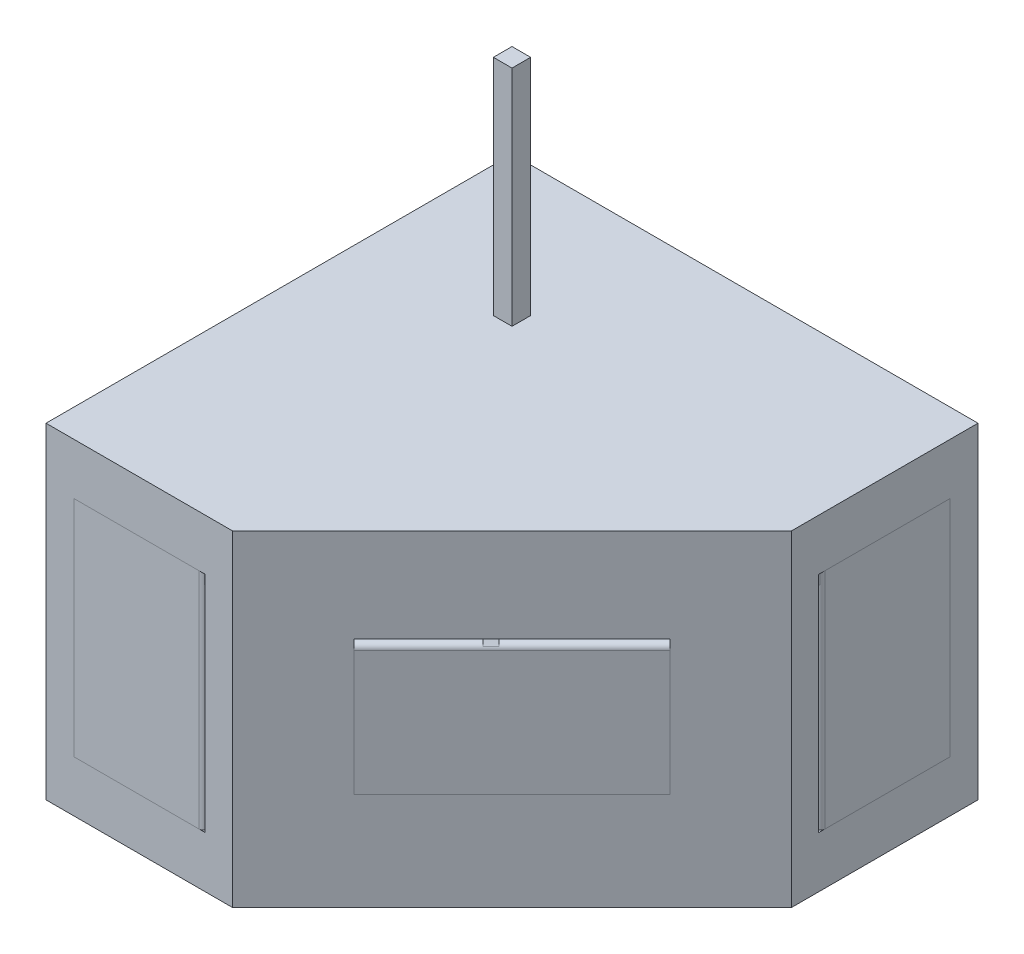
from build123d import *

# Parameters (mm, degrees)
SKETCH1_W                       = 10
SKETCH1_H                       = 10
BOSS_EXTRUDE1_DEPTH             = 175
SHELL1_T                        = 6
SKETCH1_5_W                     = 10
SKETCH1_5_H                     = 10
CUT_EXTRUDE2_DEPTH              = 10
BOSS_EXTRUDE2_DEPTH             = 120
BOSS_EXTRUDE2_DEPTH_BACK        = 12
SKETCH1_3_W                     = 10
SKETCH1_3_H                     = 10
SKETCH3_W                       = 70
SKETCH3_H                       = 120
CUT_EXTRUDE3_DEPTH              = 6
SKETCH4_W                       = 120
SKETCH4_H                       = 70
CUT_EXTRUDE4_DEPTH              = 6
SKETCH5_W                       = 70
SKETCH5_H                       = 120
CUT_EXTRUDE5_DEPTH              = 6
BOSS_EXTRUDE3_START             = 6
SKETCH7_W                       = 10
SKETCH7_H                       = 6
SKETCH7_W_2                     = 38
BOSS_EXTRUDE3_DEPTH             = 6
BOSS_EXTRUDE4_START             = 12
SKETCH7_3_W                     = 10
SKETCH7_3_H                     = 6
BOSS_EXTRUDE4_DEPTH             = 62
BOSS_EXTRUDE5_DEPTH             = 6
CUT_EXTRUDE6_DEPTH              = 3
SKETCH11_R                      = 1.5
BOSS_EXTRUDE6_DEPTH             = 15
SKETCH12_R                      = 1.5
BOSS_EXTRUDE7_DEPTH             = 6
SKETCH12_3_R                    = 1.5
BOSS_EXTRUDE8_DEPTH             = 27.5
SKETCH13_R                      = 1.5
BOSS_EXTRUDE9_DEPTH             = 120
BOSS_EXTRUDE10_DEPTH            = 6
BOSS_EXTRUDE14_DEPTH            = 126
BOSS_EXTRUDE14_DEPTH_BACK       = 6
SKETCH13_10_R                   = 1.5
INDENT1_START                   = -153.5
INDENT1_OUTLINE_R               = 1.5
INDENT1_DEPTH                   = 132
CUT_EXTRUDE12_DEPTH             = 120
SKETCH15_R                      = 1.5
BOSS_EXTRUDE15_DEPTH            = 6
SKETCH15_3_R                    = 1.5
BOSS_EXTRUDE16_DEPTH            = 21.5
CUT_EXTRUDE13_DEPTH             = 3
SKETCH17_R                      = 1.5
BOSS_EXTRUDE17_DEPTH            = 15
CUT_EXTRUDE14_DEPTH             = 3
BOSS_EXTRUDE18_REACH            = 395.172
SKETCH20_W                      = 3
SKETCH20_H                      = 3
SKETCH21_R                      = 1.5
CUT_EXTRUDE15_DEPTH             = 120
SKETCH21_5_R                    = 1.5
BOSS_EXTRUDE19_DEPTH            = 120
BOSS_EXTRUDE20_DEPTH            = 6
BOSS_EXTRUDE21_DEPTH            = 126
BOSS_EXTRUDE21_DEPTH_BACK       = 6
SKETCH21_7_R                    = 1.5
INDENT2_START                   = -153.5
INDENT2_OUTLINE_R               = 1.5
INDENT2_DEPTH                   = 132
BOSS_EXTRUDE22_DEPTH            = 7.071068
CUT_EXTRUDE16_DEPTH             = 395.493345951
CUT_EXTRUDE16_DEPTH_BACK        = 395.493345951
CUT_EXTRUDE17_DEPTH             = 12
SKETCH27_W                      = 1.5
SKETCH27_H                      = 6
SKETCH27_W_2                    = 69.32734547
SKETCH27_H_2                    = 1.5
SKETCH27_H_3                    = 31.5
BOSS_EXTRUDE23_DEPTH            = 6
BOSS_EXTRUDE25_DEPTH            = 6
SKETCH29_3_W                    = 6
SKETCH29_3_H                    = 6
BOSS_EXTRUDE26_DEPTH            = 6
SKETCH30_W                      = 1.5
SKETCH30_H                      = 1.5
BOSS_EXTRUDE27_DEPTH            = 6
BOSS_EXTRUDE28_START            = 12
BOSS_EXTRUDE28_DEPTH            = 6
BOSS_EXTRUDE29_START            = 12
SKETCH30_4_R                    = 1.5
BOSS_EXTRUDE29_DEPTH            = 6
CUT_EXTRUDE20_REACH             = 396.493
SKETCH31_R                      = 1.5
CUT_EXTRUDE20_DIRECTION_2_REACH = 396.493
SKETCH31_3_R                    = 1.5
BOSS_EXTRUDE32_DEPTH            = 60
SKETCH31_4_R                    = 1.5
BOSS_EXTRUDE33_DEPTH            = 60
BOSS_EXTRUDE34_DEPTH            = 66
BOSS_EXTRUDE34_DEPTH_BACK       = 66
SKETCH31_5_R                    = 1.5
BOSS_EXTRUDE35_START            = -4.928932
BOSS_EXTRUDE35_DEPTH            = 5.999999999
INDENT3_START                   = -66
INDENT3_OUTLINE_R               = 1.5
INDENT3_DEPTH                   = 132
INDENT3_START_2                 = -60
INDENT3_2_DEPTH                 = 120


# Read off the part's stored shape, not the designer's step: Indent1, Indent2, Indent3
with BuildPart() as part:
    # Sketch1 → Boss-Extrude1 (new body)
    # profile 1 of 2: a face of its own
    with BuildSketch(Plane(origin=(0, 0, 0), x_dir=(1, 0, 0), z_dir=(0, 1, 0))):
        Polygon((250, -100), (250, 0), (0, 0), (0, -250), (100, -250), align=None)
        with Locations((75, -75)):
            Rectangle(SKETCH1_W, SKETCH1_H, mode=Mode.SUBTRACT)
    # profile 2 of 2: a face of its own
    with BuildSketch(Plane(origin=(0, 0, 0), x_dir=(1, 0, 0), z_dir=(0, 1, 0))):
        with Locations((75, -75)):
            Rectangle(SKETCH1_W, SKETCH1_H)
    extrude(amount=-BOSS_EXTRUDE1_DEPTH)

    # Shell1 (no face opened: a closed hollow body)
    add(offset(amount=-SHELL1_T, mode=Mode.PRIVATE), mode=Mode.SUBTRACT)

    # Sketch1<5> → Cut-Extrude2 (cut)
    with BuildSketch(Plane(origin=(0, 0, 0), x_dir=(1, 0, 0), z_dir=(0, 1, 0))):
        with Locations((75, -75)):
            Rectangle(SKETCH1_5_W, SKETCH1_5_H)
    extrude(amount=-CUT_EXTRUDE2_DEPTH, mode=Mode.SUBTRACT)

    # Sketch3 → Cut-Extrude3 (cut)
    with BuildSketch(Plane.XY.offset(250)):
        with Locations((50, -87.5)):
            Rectangle(SKETCH3_W, SKETCH3_H)
    extrude(amount=-CUT_EXTRUDE3_DEPTH, mode=Mode.SUBTRACT)

    # Sketch4 → Cut-Extrude4 (cut)
    with BuildSketch(Plane(origin=(175, 0, 175), x_dir=(0.7071067811865475, 0, -0.7071067811865476), z_dir=(0.7071067811865476, 0, 0.7071067811865475))):
        with Locations((0, -87.5)):
            Rectangle(SKETCH4_W, SKETCH4_H)
    extrude(amount=-CUT_EXTRUDE4_DEPTH, mode=Mode.SUBTRACT)

    # Sketch5 → Cut-Extrude5 (cut)
    with BuildSketch(Plane(origin=(250, 0, 0), x_dir=(0, 0, -1), z_dir=(1, 0, 0))):
        with Locations((-50, -87.5)):
            Rectangle(SKETCH5_W, SKETCH5_H)
    extrude(amount=-CUT_EXTRUDE5_DEPTH, mode=Mode.SUBTRACT)

    # Sketch10 → Cut-Extrude6 (cut)
    with BuildSketch(Plane(origin=(6, 0, 0), x_dir=(0, 0, -1), z_dir=(1, 0, 0))):
        with BuildLine():
            Line((-66.462699284, -15.332431655), (-36.462699284, -147.332431655))
            ThreePointArc((-36.462699284, -147.332431655), (-34.667568345, -148.462699284), (-33.537300716, -146.667568345))
            Line((-33.537300716, -146.667568345), (-63.537300716, -14.667568345))
            ThreePointArc((-63.537300716, -14.667568345), (-65.332431655, -13.537300716), (-66.462699284, -15.332431655))
        make_face()
    extrude(amount=-CUT_EXTRUDE6_DEPTH, mode=Mode.SUBTRACT)

    # Indent1 outline → Indent1 (cut)
    with BuildSketch(Plane(origin=(0, 0, 0), x_dir=(1, 0, 0), z_dir=(0, 1, 0)).offset(INDENT1_START)):
        with Locations((247, -82)):
            Circle(INDENT1_OUTLINE_R)
    extrude(amount=INDENT1_DEPTH, mode=Mode.SUBTRACT)

    # Sketch14 → Cut-Extrude12 (cut)
    with BuildSketch(Plane.XZ.offset(27.5)):
        with BuildLine():
            Line((247.520944533, 79.045576741), (257.369022063, 80.782058518))
            ThreePointArc((257.369022063, 80.782058518), (259.802500789, 84.25742631), (256.327132997, 86.690905036))
            Line((256.327132997, 86.690905036), (246.479055467, 84.954423259))
            ThreePointArc((246.479055467, 84.954423259), (244.045576741, 81.479055467), (247.520944533, 79.045576741))
        make_face()
    extrude(amount=CUT_EXTRUDE12_DEPTH, mode=Mode.SUBTRACT)

    # Sketch16 → Cut-Extrude13 (cut)
    with BuildSketch(Plane.XZ.offset(6)):
        with BuildLine():
            Line((44.528775724, 153.683385678), (114.528775724, 183.683385678))
            ThreePointArc((114.528775724, 183.683385678), (115.316614322, 185.652982171), (113.347017829, 186.440820768))
            Line((113.347017829, 186.440820768), (43.347017829, 156.440820768))
            ThreePointArc((43.347017829, 156.440820768), (42.559179232, 154.471224276), (44.528775724, 153.683385678))
        make_face()
    extrude(amount=-CUT_EXTRUDE13_DEPTH, mode=Mode.SUBTRACT)

    # Sketch18 → Cut-Extrude14 (cut)
    with BuildSketch(Plane.XZ.offset(6)):
        Polygon((113.937896777, 216.562103223), (43.937896777, 216.562103223), (42.437896777, 216.562103223), (42.437896777, 213.562103223), (43.937896777, 213.562103223), (113.937896777, 213.562103223), (115.437896777, 213.562103223), (115.437896777, 216.562103223), align=None)
    extrude(amount=-CUT_EXTRUDE14_DEPTH, mode=Mode.SUBTRACT)

    # Sketch21 → Cut-Extrude15 (cut)
    # profile 1 of 4: a face of its own
    with BuildSketch(Plane.XZ.offset(27.5)):
        Polygon((79.251006478, 250), (15, 250), (15, 244), (80.757359313, 244), (78.889491735, 245.867867578), align=None)
    # profile 2 of 4: a face of its own
    with BuildSketch(Plane.XZ.offset(27.5)):
        with BuildLine():
            Line((84.85085067, 314.006512), (79.251006478, 250))
            Line((79.251006478, 250), (82, 250))
            ThreePointArc((82, 250), (83.148050297, 249.771638598), (84.121320344, 249.121320344))
            Line((84.121320344, 249.121320344), (85.110508265, 248.132132422))
            Line((85.110508265, 248.132132422), (90.828018858, 313.483577544))
            ThreePointArc((90.828018858, 313.483577544), (88.100901992, 316.733628866), (84.85085067, 314.006512))
        make_face()
    # profile 3 of 4: a face of its own
    with BuildSketch(Plane.XZ.offset(27.5)):
        with BuildLine():
            Line((82, 250), (79.251006478, 250))
            Line((79.251006478, 250), (78.889491735, 245.867867578))
            Line((78.889491735, 245.867867578), (80.757359313, 244))
            Line((80.757359313, 244), (82, 244))
            ThreePointArc((82, 244), (84.771638598, 245.851949703), (84.121320344, 249.121320344))
            ThreePointArc((84.121320344, 249.121320344), (83.148050297, 249.771638598), (82, 250))
        make_face()
        with Locations((82, 247)):
            Circle(SKETCH21_R, mode=Mode.SUBTRACT)
    # profile 4 of 4: a face of its own
    with BuildSketch(Plane.XZ.offset(27.5)):
        with BuildLine():
            Line((82, 244), (80.757359313, 244))
            Line((80.757359313, 244), (102.462183044, 222.295176269))
            Line((102.462183044, 222.295176269), (111.816576433, 212.94078288))
            ThreePointArc((111.816576433, 212.94078288), (116.05921712, 212.94078288), (116.05921712, 217.183423567))
            Line((116.05921712, 217.183423567), (106.704823731, 226.537816956))
            Line((106.704823731, 226.537816956), (85.110508265, 248.132132422))
            Line((85.110508265, 248.132132422), (84.121320344, 249.121320344))
            ThreePointArc((84.121320344, 249.121320344), (84.771638598, 245.851949703), (82, 244))
        make_face()
        with BuildLine():
            Line((112.877236605, 214.001443052), (103.522843216, 223.355836441))
            ThreePointArc((103.522843216, 223.355836441), (103.522843216, 225.477156784), (105.644163559, 225.477156784))
            Line((105.644163559, 225.477156784), (114.998556948, 216.122763395))
            ThreePointArc((114.998556948, 216.122763395), (114.998556948, 214.001443052), (112.877236605, 214.001443052))
        make_face(mode=Mode.SUBTRACT)
    extrude(amount=CUT_EXTRUDE15_DEPTH, mode=Mode.SUBTRACT)

    # Indent2 outline → Indent2 (cut)
    with BuildSketch(Plane(origin=(0, 0, 0), x_dir=(1, 0, 0), z_dir=(0, 1, 0)).offset(INDENT2_START)):
        with Locations((82, -247)):
            Circle(INDENT2_OUTLINE_R)
    extrude(amount=INDENT2_DEPTH, mode=Mode.SUBTRACT)

    # Sketch29 → Boss-Extrude25 (add)
    # profile 1 of 2: a face of its own
    with BuildSketch(Plane(origin=(9.242640687, 0, -9.242640687), x_dir=(-0.7071067811865476, 0, -0.7071067811865475), z_dir=(0.7071067811865475, 0, -0.7071067811865476))):
        with BuildLine():
            ThreePointArc((-224.076644221, -94.158359214), (-222.735003434, -98.183281573), (-218.710081075, -96.841640786))
            Line((-218.710081075, -96.841640786), (-204.393362648, -68.208203932))
            Line((-204.393362648, -68.208203932), (-204.393362648, -169))
            ThreePointArc((-204.393362648, -169), (-201.393362648, -172), (-198.393362648, -169))
            Line((-198.393362648, -169), (-198.393362648, -58.44542097))
            Line((-198.393362648, -58.44542097), (-178.393362648, -58.5))
            Line((-178.393362648, -58.5), (-178.393362648, -64.5))
            Line((-178.393362648, -64.5), (-172.393362648, -64.5))
            Line((-172.393362648, -64.5), (-172.393362648, -46.5))
            Line((-172.393362648, -46.5), (-178.393362648, -46.5))
            Line((-178.393362648, -46.5), (-178.393362648, -52.5))
            Line((-178.393362648, -52.5), (-196.539260681, -52.5))
            Line((-196.539260681, -52.5), (-178.710081075, -16.841640786))
            ThreePointArc((-178.710081075, -16.841640786), (-180.051721861, -12.816718427), (-184.076644221, -14.158359214))
            Line((-184.076644221, -14.158359214), (-224.076644221, -94.158359214))
        make_face()
        with BuildLine():
            ThreePointArc((-220.051721861, -96.170820393), (-222.064183041, -96.841640786), (-222.735003434, -94.829179607))
            Line((-222.735003434, -94.829179607), (-182.735003434, -14.829179607))
            ThreePointArc((-182.735003434, -14.829179607), (-180.722542254, -14.158359214), (-180.051721861, -16.170820393))
            Line((-180.051721861, -16.170820393), (-220.051721861, -96.170820393))
        make_face(mode=Mode.SUBTRACT)
    # profile 2 of 2: a face of its own
    with BuildSketch(Plane(origin=(9.242640687, 0, -9.242640687), x_dir=(-0.7071067811865476, 0, -0.7071067811865475), z_dir=(0.7071067811865475, 0, -0.7071067811865476))):
        with BuildLine():
            ThreePointArc((-148.937090391, -149.129977814), (-146.936039364, -152.871073213), (-143.194943965, -150.870022186))
            Line((-143.194943965, -150.870022186), (-129.066017178, -104.24456379))
            Line((-129.066017178, -104.24456379), (-129.066017178, -169))
            ThreePointArc((-129.066017178, -169), (-126.066017178, -172), (-123.066017178, -169))
            Line((-123.066017178, -169), (-123.066017178, -84.44456379))
            Line((-123.066017178, -84.44456379), (-103.194943965, -18.870022186))
            ThreePointArc((-103.194943965, -18.870022186), (-105.195994992, -15.128926787), (-108.937090391, -17.129977814))
            Line((-108.937090391, -17.129977814), (-148.937090391, -149.129977814))
        make_face()
        with BuildLine():
            ThreePointArc((-144.630480571, -150.435011093), (-146.501028271, -151.435536607), (-147.501553785, -149.564988907))
            Line((-147.501553785, -149.564988907), (-107.501553785, -17.564988907))
            ThreePointArc((-107.501553785, -17.564988907), (-105.631006085, -16.564463393), (-104.630480571, -18.435011093))
            Line((-104.630480571, -18.435011093), (-144.630480571, -150.435011093))
        make_face(mode=Mode.SUBTRACT)
    extrude(amount=BOSS_EXTRUDE25_DEPTH)

    # Sketch29<3> → Boss-Extrude26 (add)
    with BuildSketch(Plane(origin=(9.242640687, 0, -9.242640687), x_dir=(-0.7071067811865476, 0, -0.7071067811865475), z_dir=(0.7071067811865475, 0, -0.7071067811865476))):
        with Locations((-175.393362648, -49.5)):
            Rectangle(SKETCH29_3_W, SKETCH29_3_H)
        with Locations((-175.393362648, -61.5)):
            Rectangle(SKETCH29_3_W, SKETCH29_3_H)
    extrude(amount=-BOSS_EXTRUDE26_DEPTH)

    # Cut-Extrude20: up to this face of the body (flat: up to its plane)
    cut_extrude20_end = Plane(part.part.faces().sort_by_distance((130.452272785, -87.5, 215.305086528))[0])
    # Sketch31 → Cut-Extrude20 (cut, up to the picked face)
    with BuildSketch(Plane(origin=(0, 0, 0), x_dir=(0, 1, 0), z_dir=(0.7071067811865475, 0, -0.7071067811865476)), mode=Mode.PRIVATE) as cut_extrude20_sk1:
        with BuildLine():
            Line((-36.05332074, 284.170009932), (-57.232050808, 247.487373415))
            Line((-57.232050808, 247.487373415), (-55.5, 247.487373415))
            ThreePointArc((-55.5, 247.487373415), (-54.723542865, 247.385150894), (-54, 247.085449627))
            Line((-54, 247.085449627), (-51.401923789, 245.585449627))
            Line((-51.401923789, 245.585449627), (-30.857168317, 281.170009932))
            ThreePointArc((-30.857168317, 281.170009932), (-31.955244529, 285.268086143), (-36.05332074, 284.170009932))
        make_face()
    cut_extrude20_tool1 = split(extrude(cut_extrude20_sk1.sketch, amount=-CUT_EXTRUDE20_REACH, mode=Mode.PRIVATE), bisect_by=cut_extrude20_end, keep=Keep.BOTH, mode=Mode.PRIVATE)
    # Sketch31 → Cut-Extrude20 (cut, up to the picked face)
    with BuildSketch(Plane(origin=(0, 0, 0), x_dir=(0, 1, 0), z_dir=(0.7071067811865475, 0, -0.7071067811865476)), mode=Mode.PRIVATE) as cut_extrude20_sk2:
        with BuildLine():
            ThreePointArc((-54, 247.085449627), (-52.602222521, 245.263830551), (-52.901923789, 242.987373415))
            Line((-52.901923789, 242.987373415), (-51.401923789, 245.585449627))
            Line((-51.401923789, 245.585449627), (-54, 247.085449627))
        make_face()
    cut_extrude20_tool2 = split(extrude(cut_extrude20_sk2.sketch, amount=-CUT_EXTRUDE20_REACH, mode=Mode.PRIVATE), bisect_by=cut_extrude20_end, keep=Keep.BOTH, mode=Mode.PRIVATE)
    # Sketch31 → Cut-Extrude20 (cut, up to the picked face)
    with BuildSketch(Plane(origin=(0, 0, 0), x_dir=(0, 1, 0), z_dir=(0.7071067811865475, 0, -0.7071067811865476)), mode=Mode.PRIVATE) as cut_extrude20_sk3:
        with BuildLine():
            ThreePointArc((-57, 241.889297204), (-56.276457135, 241.589595936), (-55.5, 241.487373415))
            ThreePointArc((-55.5, 241.487373415), (-54, 241.889297204), (-52.901923789, 242.987373415))
            ThreePointArc((-52.901923789, 242.987373415), (-52.602222521, 245.263830551), (-54, 247.085449627))
            ThreePointArc((-54, 247.085449627), (-54.723542865, 247.385150894), (-55.5, 247.487373415))
            ThreePointArc((-55.5, 247.487373415), (-57, 247.085449627), (-58.098076211, 245.987373415))
            ThreePointArc((-58.098076211, 245.987373415), (-58.397777479, 243.71091628), (-57, 241.889297204))
        make_face()
        with Locations((-55.5, 244.487373415)):
            Circle(SKETCH31_R, mode=Mode.SUBTRACT)
    cut_extrude20_tool3 = split(extrude(cut_extrude20_sk3.sketch, amount=-CUT_EXTRUDE20_REACH, mode=Mode.PRIVATE), bisect_by=cut_extrude20_end, keep=Keep.BOTH, mode=Mode.PRIVATE)
    # Sketch31 → Cut-Extrude20 (cut, up to the picked face)
    with BuildSketch(Plane(origin=(0, 0, 0), x_dir=(0, 1, 0), z_dir=(0.7071067811865475, 0, -0.7071067811865476)), mode=Mode.PRIVATE) as cut_extrude20_sk4:
        with BuildLine():
            Line((-55.5, 241.487373415), (-56.303847577, 241.487373415))
            Line((-56.303847577, 241.487373415), (-17, 218.795286436))
            ThreePointArc((-17, 218.795286436), (-12.901923789, 219.893362648), (-14, 223.991438859))
            Line((-14, 223.991438859), (-51.401923789, 245.585449627))
            Line((-51.401923789, 245.585449627), (-52.901923789, 242.987373415))
            ThreePointArc((-52.901923789, 242.987373415), (-54, 241.889297204), (-55.5, 241.487373415))
        make_face()
        with BuildLine():
            Line((-16.25, 220.094324542), (-36.25, 231.641329926))
            ThreePointArc((-36.25, 231.641329926), (-36.799038106, 233.690368031), (-34.75, 234.239406137))
            Line((-34.75, 234.239406137), (-14.75, 222.692400753))
            ThreePointArc((-14.75, 222.692400753), (-14.200961894, 220.643362648), (-16.25, 220.094324542))
        make_face(mode=Mode.SUBTRACT)
    cut_extrude20_tool4 = split(extrude(cut_extrude20_sk4.sketch, amount=-CUT_EXTRUDE20_REACH, mode=Mode.PRIVATE), bisect_by=cut_extrude20_end, keep=Keep.BOTH, mode=Mode.PRIVATE)
    # Sketch31 → Cut-Extrude20 (cut, up to the picked face)
    with BuildSketch(Plane(origin=(0, 0, 0), x_dir=(0, 1, 0), z_dir=(0.7071067811865475, 0, -0.7071067811865476)), mode=Mode.PRIVATE) as cut_extrude20_sk5:
        with Locations((-55.5, 244.487373415)):
            Circle(SKETCH31_R)
    cut_extrude20_tool5 = split(extrude(cut_extrude20_sk5.sketch, amount=-CUT_EXTRUDE20_REACH, mode=Mode.PRIVATE), bisect_by=cut_extrude20_end, keep=Keep.BOTH, mode=Mode.PRIVATE)
    add(cut_extrude20_tool1.solids().sort_by(Axis((187.95088, -43.2077, 187.95088), (-0.7071067811865475, 0, 0.7071067811865476)))[0], mode=Mode.SUBTRACT)
    add(cut_extrude20_tool2.solids().sort_by(Axis((173.481701, -52.317303, 173.481701), (-0.7071067811865475, 0, 0.7071067811865476)))[0], mode=Mode.SUBTRACT)
    add(cut_extrude20_tool3.solids().sort_by(Axis((170.887597, -56.254496, 170.887597), (-0.7071067811865475, 0, 0.7071067811865476)))[0], mode=Mode.SUBTRACT)
    add(cut_extrude20_tool4.solids().sort_by(Axis((170.720903, -55.901924, 170.720903), (-0.7071067811865475, 0, 0.7071067811865476)))[0], mode=Mode.SUBTRACT)
    add(cut_extrude20_tool5.solids().sort_by(Axis((172.87868, -55.5, 172.87868), (-0.7071067811865475, 0, 0.7071067811865476)))[0], mode=Mode.SUBTRACT)

    # Cut-Extrude20 direction 2: up to this face of the body (flat: up to its plane)
    cut_extrude20_direction_2_end = Plane(part.part.faces().sort_by_distance((215.305086528, -87.5, 130.452272785))[0])
    # Sketch31 → Cut-Extrude20 direction 2 (cut, up to the picked face)
    with BuildSketch(Plane(origin=(0, 0, 0), x_dir=(0, 1, 0), z_dir=(0.7071067811865475, 0, -0.7071067811865476)), mode=Mode.PRIVATE) as cut_extrude20_direction_2_sk1:
        with BuildLine():
            Line((-36.05332074, 284.170009932), (-57.232050808, 247.487373415))
            Line((-57.232050808, 247.487373415), (-55.5, 247.487373415))
            ThreePointArc((-55.5, 247.487373415), (-54.723542865, 247.385150894), (-54, 247.085449627))
            Line((-54, 247.085449627), (-51.401923789, 245.585449627))
            Line((-51.401923789, 245.585449627), (-30.857168317, 281.170009932))
            ThreePointArc((-30.857168317, 281.170009932), (-31.955244529, 285.268086143), (-36.05332074, 284.170009932))
        make_face()
    cut_extrude20_direction_2_tool1 = split(extrude(cut_extrude20_direction_2_sk1.sketch, amount=CUT_EXTRUDE20_DIRECTION_2_REACH, mode=Mode.PRIVATE), bisect_by=cut_extrude20_direction_2_end, keep=Keep.BOTH, mode=Mode.PRIVATE)
    # Sketch31 → Cut-Extrude20 direction 2 (cut, up to the picked face)
    with BuildSketch(Plane(origin=(0, 0, 0), x_dir=(0, 1, 0), z_dir=(0.7071067811865475, 0, -0.7071067811865476)), mode=Mode.PRIVATE) as cut_extrude20_direction_2_sk2:
        with BuildLine():
            ThreePointArc((-54, 247.085449627), (-52.602222521, 245.263830551), (-52.901923789, 242.987373415))
            Line((-52.901923789, 242.987373415), (-51.401923789, 245.585449627))
            Line((-51.401923789, 245.585449627), (-54, 247.085449627))
        make_face()
    cut_extrude20_direction_2_tool2 = split(extrude(cut_extrude20_direction_2_sk2.sketch, amount=CUT_EXTRUDE20_DIRECTION_2_REACH, mode=Mode.PRIVATE), bisect_by=cut_extrude20_direction_2_end, keep=Keep.BOTH, mode=Mode.PRIVATE)
    # Sketch31 → Cut-Extrude20 direction 2 (cut, up to the picked face)
    with BuildSketch(Plane(origin=(0, 0, 0), x_dir=(0, 1, 0), z_dir=(0.7071067811865475, 0, -0.7071067811865476)), mode=Mode.PRIVATE) as cut_extrude20_direction_2_sk3:
        with BuildLine():
            ThreePointArc((-57, 241.889297204), (-56.276457135, 241.589595936), (-55.5, 241.487373415))
            ThreePointArc((-55.5, 241.487373415), (-54, 241.889297204), (-52.901923789, 242.987373415))
            ThreePointArc((-52.901923789, 242.987373415), (-52.602222521, 245.263830551), (-54, 247.085449627))
            ThreePointArc((-54, 247.085449627), (-54.723542865, 247.385150894), (-55.5, 247.487373415))
            ThreePointArc((-55.5, 247.487373415), (-57, 247.085449627), (-58.098076211, 245.987373415))
            ThreePointArc((-58.098076211, 245.987373415), (-58.397777479, 243.71091628), (-57, 241.889297204))
        make_face()
        with Locations((-55.5, 244.487373415)):
            Circle(SKETCH31_R, mode=Mode.SUBTRACT)
    cut_extrude20_direction_2_tool3 = split(extrude(cut_extrude20_direction_2_sk3.sketch, amount=CUT_EXTRUDE20_DIRECTION_2_REACH, mode=Mode.PRIVATE), bisect_by=cut_extrude20_direction_2_end, keep=Keep.BOTH, mode=Mode.PRIVATE)
    # Sketch31 → Cut-Extrude20 direction 2 (cut, up to the picked face)
    with BuildSketch(Plane(origin=(0, 0, 0), x_dir=(0, 1, 0), z_dir=(0.7071067811865475, 0, -0.7071067811865476)), mode=Mode.PRIVATE) as cut_extrude20_direction_2_sk4:
        with BuildLine():
            Line((-55.5, 241.487373415), (-56.303847577, 241.487373415))
            Line((-56.303847577, 241.487373415), (-17, 218.795286436))
            ThreePointArc((-17, 218.795286436), (-12.901923789, 219.893362648), (-14, 223.991438859))
            Line((-14, 223.991438859), (-51.401923789, 245.585449627))
            Line((-51.401923789, 245.585449627), (-52.901923789, 242.987373415))
            ThreePointArc((-52.901923789, 242.987373415), (-54, 241.889297204), (-55.5, 241.487373415))
        make_face()
        with BuildLine():
            Line((-16.25, 220.094324542), (-36.25, 231.641329926))
            ThreePointArc((-36.25, 231.641329926), (-36.799038106, 233.690368031), (-34.75, 234.239406137))
            Line((-34.75, 234.239406137), (-14.75, 222.692400753))
            ThreePointArc((-14.75, 222.692400753), (-14.200961894, 220.643362648), (-16.25, 220.094324542))
        make_face(mode=Mode.SUBTRACT)
    cut_extrude20_direction_2_tool4 = split(extrude(cut_extrude20_direction_2_sk4.sketch, amount=CUT_EXTRUDE20_DIRECTION_2_REACH, mode=Mode.PRIVATE), bisect_by=cut_extrude20_direction_2_end, keep=Keep.BOTH, mode=Mode.PRIVATE)
    # Sketch31 → Cut-Extrude20 direction 2 (cut, up to the picked face)
    with BuildSketch(Plane(origin=(0, 0, 0), x_dir=(0, 1, 0), z_dir=(0.7071067811865475, 0, -0.7071067811865476)), mode=Mode.PRIVATE) as cut_extrude20_direction_2_sk5:
        with Locations((-55.5, 244.487373415)):
            Circle(SKETCH31_R)
    cut_extrude20_direction_2_tool5 = split(extrude(cut_extrude20_direction_2_sk5.sketch, amount=CUT_EXTRUDE20_DIRECTION_2_REACH, mode=Mode.PRIVATE), bisect_by=cut_extrude20_direction_2_end, keep=Keep.BOTH, mode=Mode.PRIVATE)
    add(cut_extrude20_direction_2_tool1.solids().sort_by(Axis((187.95088, -43.2077, 187.95088), (0.7071067811865475, 0, -0.7071067811865476)))[0], mode=Mode.SUBTRACT)
    add(cut_extrude20_direction_2_tool2.solids().sort_by(Axis((173.481701, -52.317303, 173.481701), (0.7071067811865475, 0, -0.7071067811865476)))[0], mode=Mode.SUBTRACT)
    add(cut_extrude20_direction_2_tool3.solids().sort_by(Axis((170.887597, -56.254496, 170.887597), (0.7071067811865475, 0, -0.7071067811865476)))[0], mode=Mode.SUBTRACT)
    add(cut_extrude20_direction_2_tool4.solids().sort_by(Axis((170.720903, -55.901924, 170.720903), (0.7071067811865475, 0, -0.7071067811865476)))[0], mode=Mode.SUBTRACT)
    add(cut_extrude20_direction_2_tool5.solids().sort_by(Axis((172.87868, -55.5, 172.87868), (0.7071067811865475, 0, -0.7071067811865476)))[0], mode=Mode.SUBTRACT)

    # Indent3 outline → Indent3 (cut)
    with BuildSketch(Plane(origin=(0, 0, 0), x_dir=(0.707106781186548, 0, 0.707106781186547), z_dir=(0.707106781186547, 0, -0.707106781186548)).offset(INDENT3_START)):
        with Locations((244.487373415, 55.5)):
            Circle(INDENT3_OUTLINE_R)
    extrude(amount=INDENT3_DEPTH, mode=Mode.SUBTRACT)

    # Indent3 2 outline → Indent3 2 (cut)
    with BuildSketch(Plane(origin=(0, 0, 0), x_dir=(0.707106781186548, 0, 0.707106781186547), z_dir=(0.707106781186547, 0, -0.707106781186548)).offset(INDENT3_START_2)):
        with BuildLine():
            Line((241.487373415, 122.5), (247.487373415, 122.5))
            ThreePointArc((247.487373415, 122.5), (244.487373415, 122.567130548), (241.487373415, 122.5))
        make_face()
    extrude(amount=INDENT3_2_DEPTH, mode=Mode.SUBTRACT)


with BuildPart() as body_2:
    # Sketch1<3> → Boss-Extrude2 (new, two sides: drawn at the far end of the back side and taken through both)
    with BuildSketch(Plane(origin=(0, 0, 0), x_dir=(1, 0, 0), z_dir=(0, 1, 0)).offset(-BOSS_EXTRUDE2_DEPTH_BACK)):
        with Locations((75, -75)):
            Rectangle(SKETCH1_3_W, SKETCH1_3_H)
    extrude(amount=BOSS_EXTRUDE2_DEPTH + BOSS_EXTRUDE2_DEPTH_BACK)



with BuildPart() as body_3:
    # Sketch7 → Boss-Extrude3 (new body)
    # profile 1 of 2: a face of its own
    with BuildSketch(Plane(origin=(6, 0, 0), x_dir=(0, 0, -1), z_dir=(1, 0, 0)).offset(BOSS_EXTRUDE3_START)):
        with Locations((-75, -15)):
            Rectangle(SKETCH7_W, SKETCH7_H)
    # profile 2 of 2: a face of its own
    with BuildSketch(Plane(origin=(6, 0, 0), x_dir=(0, 0, -1), z_dir=(1, 0, 0)).offset(BOSS_EXTRUDE3_START)):
        with Locations((-51, -15)):
            Rectangle(SKETCH7_W_2, SKETCH7_H)
        with BuildLine():
            Line((-65, -13.5), (-35, -13.5))
            ThreePointArc((-35, -13.5), (-33.5, -15), (-35, -16.5))
            Line((-35, -16.5), (-65, -16.5))
            ThreePointArc((-65, -16.5), (-66.5, -15), (-65, -13.5))
        make_face(mode=Mode.SUBTRACT)
    extrude(amount=BOSS_EXTRUDE3_DEPTH)


with BuildPart() as body_2_1:
    add(body_2.part)

    add(body_3.part)  # Boss-Extrude4 merges body 3
    # Sketch7<3> → Boss-Extrude4 (add)
    with BuildSketch(Plane(origin=(6, 0, 0), x_dir=(0, 0, -1), z_dir=(1, 0, 0)).offset(BOSS_EXTRUDE4_START)):
        with Locations((-75, -15)):
            Rectangle(SKETCH7_3_W, SKETCH7_3_H)
    extrude(amount=BOSS_EXTRUDE4_DEPTH)

    # Sketch24 → Boss-Extrude22 (add)
    with BuildSketch(Plane(origin=(0, 0, 0), x_dir=(0, 1, 0), z_dir=(0.7071067811865475, 0, -0.7071067811865476))):
        with BuildLine():
            Line((-15, 106.066017178), (-15, 146.066017178))
            ThreePointArc((-15, 146.066017178), (-18, 149.066017178), (-21, 146.066017178))
            Line((-21, 146.066017178), (-21, 106.066017178))
            ThreePointArc((-21, 106.066017178), (-18, 103.066017178), (-15, 106.066017178))
        make_face()
        with BuildLine():
            Line((-16.5, 106.066017178), (-16.5, 146.066017178))
            ThreePointArc((-16.5, 146.066017178), (-18, 147.566017178), (-19.5, 146.066017178))
            Line((-19.5, 146.066017178), (-19.5, 106.066017178))
            ThreePointArc((-19.5, 106.066017178), (-18, 104.566017178), (-16.5, 106.066017178))
        make_face(mode=Mode.SUBTRACT)
    extrude(amount=BOSS_EXTRUDE22_DEPTH)

    # Sketch24<2> → Cut-Extrude16 (cut, two sides: drawn at the far end of the back side and taken through both)
    with BuildSketch(Plane(origin=(0, 0, 0), x_dir=(0, 1, 0), z_dir=(0.7071067811865475, 0, -0.7071067811865476)).offset(-CUT_EXTRUDE16_DEPTH_BACK)):
        with BuildLine():
            Line((-16.5, 106.066017178), (-16.5, 146.066017178))
            ThreePointArc((-16.5, 146.066017178), (-18, 147.566017178), (-19.5, 146.066017178))
            Line((-19.5, 146.066017178), (-19.5, 106.066017178))
            ThreePointArc((-19.5, 106.066017178), (-18, 104.566017178), (-16.5, 106.066017178))
        make_face()
    extrude(amount=CUT_EXTRUDE16_DEPTH + CUT_EXTRUDE16_DEPTH_BACK, mode=Mode.SUBTRACT)

    # Sketch24<4> → Cut-Extrude17 (cut)
    with BuildSketch(Plane(origin=(0, 0, 0), x_dir=(0, 1, 0), z_dir=(0.7071067811865475, 0, -0.7071067811865476))):
        with BuildLine():
            Line((-15, 106.066017178), (-15, 146.066017178))
            ThreePointArc((-15, 146.066017178), (-18, 149.066017178), (-21, 146.066017178))
            Line((-21, 146.066017178), (-21, 106.066017178))
            ThreePointArc((-21, 106.066017178), (-18, 103.066017178), (-15, 106.066017178))
        make_face()
        with BuildLine():
            Line((-16.5, 106.066017178), (-16.5, 146.066017178))
            ThreePointArc((-16.5, 146.066017178), (-18, 147.566017178), (-19.5, 146.066017178))
            Line((-19.5, 146.066017178), (-19.5, 106.066017178))
            ThreePointArc((-19.5, 106.066017178), (-18, 104.566017178), (-16.5, 106.066017178))
        make_face(mode=Mode.SUBTRACT)
    extrude(amount=-CUT_EXTRUDE17_DEPTH, mode=Mode.SUBTRACT)


with BuildPart() as body_3_2:
    # Sketch8 → Boss-Extrude5 (new body)
    with BuildSketch(Plane(origin=(6, 0, 0), x_dir=(0, 0, -1), z_dir=(1, 0, 0))):
        Polygon((-68, -15), (-68, -147), (-68, -150), (-62, -150), (-62, -147), (-62, -15), (-62, -6), (-68, -6), align=None)
        with BuildLine():
            Line((-66.5, -15), (-66.5, -147))
            ThreePointArc((-66.5, -147), (-65, -148.5), (-63.5, -147))
            Line((-63.5, -147), (-63.5, -15))
            ThreePointArc((-63.5, -15), (-65, -13.5), (-66.5, -15))
        make_face(mode=Mode.SUBTRACT)
    extrude(amount=BOSS_EXTRUDE5_DEPTH)

    # Sketch12 → Boss-Extrude7 (add)
    # profile 1 of 3: a face of its own
    with BuildSketch(Plane.XZ.offset(6)):
        with BuildLine():
            Line((110.937896777, 68), (12, 68))
            Line((12, 68), (12, 62))
            Line((12, 62), (116.937896777, 62))
            Line((116.937896777, 62), (116.937896777, 94))
            Line((116.937896777, 94), (116.937896777, 100))
            Line((116.937896777, 100), (116.937896777, 188.062103223))
            Line((116.937896777, 188.062103223), (43.937896777, 188.062103223))
            ThreePointArc((43.937896777, 188.062103223), (40.937896777, 185.062103223), (43.937896777, 182.062103223))
            Line((43.937896777, 182.062103223), (110.937896777, 182.062103223))
            Line((110.937896777, 182.062103223), (110.937896777, 68))
        make_face()
        with BuildLine():
            Line((43.937896777, 186.562103223), (113.937896777, 186.562103223))
            ThreePointArc((113.937896777, 186.562103223), (115.437896777, 185.062103223), (113.937896777, 183.562103223))
            Line((113.937896777, 183.562103223), (43.937896777, 183.562103223))
            ThreePointArc((43.937896777, 183.562103223), (42.437896777, 185.062103223), (43.937896777, 186.562103223))
        make_face(mode=Mode.SUBTRACT)
    # profile 2 of 3: a face of its own
    with BuildSketch(Plane.XZ.offset(6)):
        with BuildLine():
            Line((116.937896777, 100), (116.937896777, 94))
            Line((116.937896777, 94), (234.413505532, 94))
            ThreePointArc((234.413505532, 94), (237.413505532, 97), (234.413505532, 100))
            Line((234.413505532, 100), (116.937896777, 100))
        make_face()
        with Locations((234.413505532, 97)):
            Circle(SKETCH12_R, mode=Mode.SUBTRACT)
    # profile 3 of 3: a face of its own
    with BuildSketch(Plane.XZ.offset(6)):
        with Locations((234.413505532, 97)):
            Circle(SKETCH12_R)
    extrude(amount=BOSS_EXTRUDE7_DEPTH)

    # Sketch12<3> → Boss-Extrude8 (add)
    with BuildSketch(Plane.XZ.offset(6)):
        with Locations(Location((234.413505532, 97, 0), (0, 0, 90))):
            Circle(SKETCH12_3_R)
    extrude(amount=BOSS_EXTRUDE8_DEPTH)


with BuildPart() as body_4:
    # Sketch11 → Boss-Extrude6 (new body)
    with BuildSketch(Plane(origin=(3, 0, 0), x_dir=(0, 0, -1), z_dir=(1, 0, 0))):
        with Locations((-65, -15)):
            Circle(SKETCH11_R)
    extrude(amount=BOSS_EXTRUDE6_DEPTH)


with BuildPart() as body_5:
    # Sketch13 → Boss-Extrude9 (new body)
    # profile 1 of 2: a face of its own
    with BuildSketch(Plane.XZ.offset(27.5)):
        with BuildLine():
            Line((244, 80.908089297), (244, 15))
            Line((244, 15), (250, 15))
            Line((250, 15), (250, 82))
            ThreePointArc((250, 82), (249.819077862, 83.02606043), (249.298133329, 83.928362829))
            ThreePointArc((249.298133329, 83.928362829), (245.97393957, 84.819077862), (244, 82))
            Line((244, 82), (244, 80.908089297))
        make_face()
        with Locations((247, 82)):
            Circle(SKETCH13_R, mode=Mode.SUBTRACT)
    # profile 2 of 2: a face of its own
    with BuildSketch(Plane.XZ.offset(27.5)):
        with Locations((247, 82)):
            Circle(SKETCH13_R)
    extrude(amount=BOSS_EXTRUDE9_DEPTH)

    # Sketch13<7> → Boss-Extrude10 (add)
    # profile 1 of 3: a face of its own
    with BuildSketch(Plane.XZ.offset(27.5)):
        with BuildLine():
            Line((236.611423977, 89.713451316), (244, 80.908089297))
            Line((244, 80.908089297), (244, 82))
            Line((244, 82), (244, 85))
            Line((244, 85), (246.999999991, 85))
            Line((246.999999991, 85), (248.398922974, 85))
            Line((248.398922974, 85), (241.207690636, 93.570176974))
            Line((241.207690636, 93.570176974), (236.711638862, 98.928362829))
            ThreePointArc((236.711638862, 98.928362829), (232.485142703, 99.298133329), (232.115372203, 95.071637171))
            Line((232.115372203, 95.071637171), (236.611423977, 89.713451316))
        make_face()
        with BuildLine():
            Line((237.760490642, 90.677632731), (233.264438868, 96.035818585))
            ThreePointArc((233.264438868, 96.035818585), (233.449324118, 98.149066665), (235.562572197, 97.964181415))
            Line((235.562572197, 97.964181415), (240.058623971, 92.60599556))
            ThreePointArc((240.058623971, 92.60599556), (239.873738721, 90.492747481), (237.760490642, 90.677632731))
        make_face(mode=Mode.SUBTRACT)
    # profile 2 of 3: a face of its own
    with BuildSketch(Plane.XZ.offset(27.5)):
        with BuildLine():
            Line((244, 85), (244, 82))
            ThreePointArc((244, 82), (244.878679653, 84.12132034), (246.999999991, 85))
            Line((246.999999991, 85), (244, 85))
        make_face()
    # profile 3 of 3: a face of its own
    with BuildSketch(Plane.XZ.offset(27.5)):
        with BuildLine():
            ThreePointArc((246.999999991, 85), (248.267854781, 84.718923363), (249.298133329, 83.928362829))
            Line((249.298133329, 83.928362829), (248.398922974, 85))
            Line((248.398922974, 85), (246.999999991, 85))
        make_face()
    extrude(amount=BOSS_EXTRUDE10_DEPTH)

    # Sketch13<10> → Boss-Extrude14 (add, two sides: drawn at the far end of the back side and taken through both)
    with BuildSketch(Plane.XZ.offset(27.5).offset(-BOSS_EXTRUDE14_DEPTH_BACK)):
        with Locations(Location((247, 82, 0), (0, 0, 90))):
            Circle(SKETCH13_10_R)
    extrude(amount=BOSS_EXTRUDE14_DEPTH + BOSS_EXTRUDE14_DEPTH_BACK)


with BuildPart() as body_6:
    # Sketch15 → Boss-Extrude15 (new body)
    # profile 1 of 4: a face of its own
    with BuildSketch(Plane.XZ.offset(12)):
        with BuildLine():
            ThreePointArc((116.937896777, 215.062103223), (113.937896777, 218.062103223), (110.937896777, 215.062103223))
            Line((110.937896777, 215.062103223), (110.937896777, 188.062103223))
            Line((110.937896777, 188.062103223), (116.937896777, 188.062103223))
            Line((116.937896777, 188.062103223), (116.937896777, 215.062103223))
        make_face()
        with Locations((113.937896777, 215.062103223)):
            Circle(SKETCH15_R, mode=Mode.SUBTRACT)
    # profile 2 of 4: a face of its own
    with BuildSketch(Plane.XZ.offset(12)):
        with Locations((113.937896777, 215.062103223)):
            Circle(SKETCH15_R)
    # profile 3 of 4: a face of its own
    with BuildSketch(Plane.XZ.offset(12)):
        with BuildLine():
            Line((116.937896777, 188.062103223), (110.937896777, 188.062103223))
            Line((110.937896777, 188.062103223), (110.937896777, 186.562103223))
            Line((110.937896777, 186.562103223), (113.937896777, 186.562103223))
            ThreePointArc((113.937896777, 186.562103223), (114.998556948, 186.122763395), (115.437896777, 185.062103223))
            Line((115.437896777, 185.062103223), (115.437896777, 155.062103223))
            ThreePointArc((115.437896777, 155.062103223), (113.937896777, 153.562103223), (112.437896777, 155.062103223))
            Line((112.437896777, 155.062103223), (112.437896777, 183.562103223))
            Line((112.437896777, 183.562103223), (110.937896777, 183.562103223))
            Line((110.937896777, 183.562103223), (110.937896777, 182.062103223))
            Line((110.937896777, 182.062103223), (110.937896777, 155.062103223))
            ThreePointArc((110.937896777, 155.062103223), (113.937896777, 152.062103223), (116.937896777, 155.062103223))
            Line((116.937896777, 155.062103223), (116.937896777, 185.062103223))
            Line((116.937896777, 185.062103223), (116.937896777, 188.062103223))
        make_face()
    # profile 4 of 4: a face of its own
    with BuildSketch(Plane.XZ.offset(12)):
        with BuildLine():
            Line((113.937896777, 186.562103223), (110.937896777, 186.562103223))
            Line((110.937896777, 186.562103223), (110.937896777, 185.062103223))
            Line((110.937896777, 185.062103223), (110.937896777, 183.562103223))
            Line((110.937896777, 183.562103223), (112.437896777, 183.562103223))
            Line((112.437896777, 183.562103223), (112.437896777, 185.062103223))
            ThreePointArc((112.437896777, 185.062103223), (112.877236605, 186.122763395), (113.937896777, 186.562103223))
        make_face()
    extrude(amount=BOSS_EXTRUDE15_DEPTH)

    # Sketch15<3> → Boss-Extrude16 (add)
    with BuildSketch(Plane.XZ.offset(12)):
        with Locations(Location((113.937896777, 215.062103223, 0), (0, 0, 90))):
            Circle(SKETCH15_3_R)
    extrude(amount=BOSS_EXTRUDE16_DEPTH)

    # Sketch20 → Boss-Extrude18 (add, up to next)
    with BuildSketch(Plane.XZ.offset(3), mode=Mode.PRIVATE) as boss_extrude18_sk1:
        with Locations((113.937896777, 215.062103223)):
            Rectangle(SKETCH20_W, SKETCH20_H)
    boss_extrude18_tool1 = extrude(boss_extrude18_sk1.sketch, amount=BOSS_EXTRUDE18_REACH, mode=Mode.PRIVATE) - body_6.part
    add(boss_extrude18_tool1.solids().sort_by_distance((113.937897, -3, 215.062103))[0])


with BuildPart() as body_7:
    # Sketch17 → Boss-Extrude17 (new body)
    with BuildSketch(Plane.XZ.offset(3)):
        with Locations(Location((113.937896777, 185.062103223, 0), (0, 0, 270))):
            Circle(SKETCH17_R)
    extrude(amount=BOSS_EXTRUDE17_DEPTH)


with BuildPart() as body_8:
    # Sketch21<5> → Boss-Extrude19 (new body)
    # profile 1 of 3: a face of its own
    with BuildSketch(Plane.XZ.offset(27.5)):
        Polygon((79.251006478, 250), (15, 250), (15, 244), (80.757359313, 244), (78.889491735, 245.867867578), align=None)
    # profile 2 of 3: a face of its own
    with BuildSketch(Plane.XZ.offset(27.5)):
        with BuildLine():
            Line((82, 250), (79.251006478, 250))
            Line((79.251006478, 250), (78.889491735, 245.867867578))
            Line((78.889491735, 245.867867578), (80.757359313, 244))
            Line((80.757359313, 244), (82, 244))
            ThreePointArc((82, 244), (84.771638598, 245.851949703), (84.121320344, 249.121320344))
            ThreePointArc((84.121320344, 249.121320344), (83.148050297, 249.771638598), (82, 250))
        make_face()
        with Locations((82, 247)):
            Circle(SKETCH21_5_R, mode=Mode.SUBTRACT)
    # profile 3 of 3: a face of its own
    with BuildSketch(Plane.XZ.offset(27.5)):
        with Locations((82, 247)):
            Circle(SKETCH21_5_R)
    extrude(amount=BOSS_EXTRUDE19_DEPTH)

    # Sketch21<6> → Boss-Extrude20 (add)
    # profile 1 of 3: a face of its own
    with BuildSketch(Plane.XZ.offset(27.5)):
        with BuildLine():
            Line((82, 244), (80.757359313, 244))
            Line((80.757359313, 244), (102.462183044, 222.295176269))
            Line((102.462183044, 222.295176269), (111.816576433, 212.94078288))
            ThreePointArc((111.816576433, 212.94078288), (116.05921712, 212.94078288), (116.05921712, 217.183423567))
            Line((116.05921712, 217.183423567), (106.704823731, 226.537816956))
            Line((106.704823731, 226.537816956), (85.110508265, 248.132132422))
            Line((85.110508265, 248.132132422), (85, 248.242640687))
            Line((85, 248.242640687), (85, 247))
            Line((85, 247), (85, 244))
            Line((85, 244), (82, 244))
        make_face()
        with BuildLine():
            Line((112.877236605, 214.001443052), (103.522843216, 223.355836441))
            ThreePointArc((103.522843216, 223.355836441), (103.522843216, 225.477156784), (105.644163559, 225.477156784))
            Line((105.644163559, 225.477156784), (114.998556948, 216.122763395))
            ThreePointArc((114.998556948, 216.122763395), (114.998556948, 214.001443052), (112.877236605, 214.001443052))
        make_face(mode=Mode.SUBTRACT)
    # profile 2 of 3: a face of its own
    with BuildSketch(Plane.XZ.offset(27.5)):
        with BuildLine():
            ThreePointArc((85, 247), (84.121320344, 244.878679656), (82, 244))
            Line((82, 244), (85, 244))
            Line((85, 244), (85, 247))
        make_face()
    # profile 3 of 3: a face of its own
    with BuildSketch(Plane.XZ.offset(27.5)):
        with BuildLine():
            Line((85, 248.242640687), (84.121320344, 249.121320344))
            ThreePointArc((84.121320344, 249.121320344), (84.771638598, 248.148050297), (85, 247))
            Line((85, 247), (85, 248.242640687))
        make_face()
    extrude(amount=BOSS_EXTRUDE20_DEPTH)

    # Sketch21<7> → Boss-Extrude21 (add, two sides: drawn at the far end of the back side and taken through both)
    with BuildSketch(Plane.XZ.offset(27.5).offset(-BOSS_EXTRUDE21_DEPTH_BACK)):
        with Locations(Location((82, 247, 0), (0, 0, 90))):
            Circle(SKETCH21_7_R)
    extrude(amount=BOSS_EXTRUDE21_DEPTH + BOSS_EXTRUDE21_DEPTH_BACK)


with BuildPart() as body_9:
    # Sketch27 → Boss-Extrude23 (new body)
    with BuildSketch(Plane(origin=(5, 0, -5), x_dir=(-0.7071067811865476, 0, -0.7071067811865475), z_dir=(0.7071067811865475, 0, -0.7071067811865476))):
        with BuildLine():
            Line((-179.893362648, -52.5), (-178.393362648, -52.5))
            Line((-178.393362648, -52.5), (-178.393362648, -15.5))
            ThreePointArc((-178.393362648, -15.5), (-181.393362648, -12.5), (-184.393362648, -15.5))
            Line((-184.393362648, -15.5), (-184.393362648, -55.5))
            ThreePointArc((-184.393362648, -55.5), (-183.991438859, -54), (-182.893362648, -52.901923789))
            Line((-182.893362648, -52.901923789), (-182.893362648, -15.5))
            ThreePointArc((-182.893362648, -15.5), (-181.393362648, -14), (-179.893362648, -15.5))
            Line((-179.893362648, -15.5), (-179.893362648, -52.5))
        make_face()
        with BuildLine():
            ThreePointArc((-182.893362648, -52.901923789), (-183.991438859, -54), (-184.393362648, -55.5))
            ThreePointArc((-184.393362648, -55.5), (-183.991438859, -57), (-182.893362648, -58.098076211))
            Line((-182.893362648, -58.098076211), (-182.893362648, -52.901923789))
        make_face()
        with Locations((-179.143362648, -55.5)):
            Rectangle(SKETCH27_W, SKETCH27_H)
        with BuildLine():
            ThreePointArc((-184.393362648, -95.5), (-181.393362648, -98.5), (-178.393362648, -95.5))
            Line((-178.393362648, -95.5), (-178.393362648, -58.5))
            Line((-178.393362648, -58.5), (-179.893362648, -58.5))
            Line((-179.893362648, -58.5), (-179.893362648, -95.5))
            ThreePointArc((-179.893362648, -95.5), (-181.393362648, -97), (-182.893362648, -95.5))
            Line((-182.893362648, -95.5), (-182.893362648, -58.098076211))
            ThreePointArc((-182.893362648, -58.098076211), (-183.991438859, -57), (-184.393362648, -55.5))
            Line((-184.393362648, -55.5), (-184.393362648, -95.5))
        make_face()
        with Locations((-143.729689913, -55.5)):
            Rectangle(SKETCH27_W_2, SKETCH27_H)
        with BuildLine():
            ThreePointArc((-104.566017178, -52.901923789), (-103.467940967, -54), (-103.066017178, -55.5))
            Line((-103.066017178, -55.5), (-103.066017178, -18))
            ThreePointArc((-103.066017178, -18), (-103.467940967, -19.5), (-104.566017178, -20.598076211))
            Line((-104.566017178, -20.598076211), (-104.566017178, -52.901923789))
        make_face()
        with BuildLine():
            ThreePointArc((-104.566017178, -20.598076211), (-103.467940967, -19.5), (-103.066017178, -18))
            ThreePointArc((-103.066017178, -18), (-103.944696834, -15.878679656), (-106.066017178, -15))
            ThreePointArc((-106.066017178, -15), (-107.566017178, -15.401923789), (-108.664093389, -16.5))
            Line((-108.664093389, -16.5), (-106.066017178, -16.5))
            ThreePointArc((-106.066017178, -16.5), (-105.005357006, -16.939339828), (-104.566017178, -18))
            Line((-104.566017178, -18), (-104.566017178, -20.598076211))
        make_face()
        with BuildLine():
            Line((-109.066017178, -18), (-109.066017178, -19.5))
            Line((-109.066017178, -19.5), (-107.566017178, -19.5))
            Line((-107.566017178, -19.5), (-107.566017178, -18))
            ThreePointArc((-107.566017178, -18), (-107.12667735, -16.939339828), (-106.066017178, -16.5))
            Line((-106.066017178, -16.5), (-108.664093389, -16.5))
            ThreePointArc((-108.664093389, -16.5), (-108.963794657, -17.223542865), (-109.066017178, -18))
        make_face()
        with Locations((-108.316017178, -20.25)):
            Rectangle(SKETCH27_W, SKETCH27_H_2)
        with Locations((-108.316017178, -36.75)):
            Rectangle(SKETCH27_W, SKETCH27_H_3)
        with Locations((-108.316017178, -55.5)):
            Rectangle(SKETCH27_W, SKETCH27_H)
        with BuildLine():
            Line((-104.566017178, -52.901923789), (-104.566017178, -58.098076211))
            ThreePointArc((-104.566017178, -58.098076211), (-103.467940967, -57), (-103.066017178, -55.5))
            ThreePointArc((-103.066017178, -55.5), (-103.467940967, -54), (-104.566017178, -52.901923789))
        make_face()
        with BuildLine():
            Line((-107.566017178, -58.5), (-109.066017178, -58.5))
            Line((-109.066017178, -58.5), (-109.066017178, -150))
            ThreePointArc((-109.066017178, -150), (-106.066017178, -153), (-103.066017178, -150))
            Line((-103.066017178, -150), (-103.066017178, -55.5))
            ThreePointArc((-103.066017178, -55.5), (-103.467940967, -57), (-104.566017178, -58.098076211))
            Line((-104.566017178, -58.098076211), (-104.566017178, -150))
            ThreePointArc((-104.566017178, -150), (-106.066017178, -151.5), (-107.566017178, -150))
            Line((-107.566017178, -150), (-107.566017178, -58.5))
        make_face()
    extrude(amount=BOSS_EXTRUDE23_DEPTH)


with BuildPart() as body_10:
    # Sketch30 → Boss-Extrude27 (new body)
    with BuildSketch(Plane(origin=(5, 0, -5), x_dir=(0.7071067811865476, 0, 0.7071067811865475), z_dir=(-0.7071067811865475, 0, 0.7071067811865476))):
        with BuildLine():
            Line((183.991438859, -14), (221.393362648, -14))
            ThreePointArc((221.393362648, -14), (222.454022819, -14.439339828), (222.893362648, -15.5))
            ThreePointArc((222.893362648, -15.5), (222.454022819, -16.560660172), (221.393362648, -17))
            Line((221.393362648, -17), (184.393362648, -17))
            Line((184.393362648, -17), (184.393362648, -18.5))
            Line((184.393362648, -18.5), (221.393362648, -18.5))
            ThreePointArc((221.393362648, -18.5), (224.393362648, -15.5), (221.393362648, -12.5))
            Line((221.393362648, -12.5), (181.393362648, -12.5))
            ThreePointArc((181.393362648, -12.5), (182.893362648, -12.901923789), (183.991438859, -14))
        make_face()
        with BuildLine():
            Line((181.393362648, -14), (183.991438859, -14))
            ThreePointArc((183.991438859, -14), (182.893362648, -12.901923789), (181.393362648, -12.5))
            ThreePointArc((181.393362648, -12.5), (179.272042304, -13.378679656), (178.393362648, -15.5))
            ThreePointArc((178.393362648, -15.5), (178.795286436, -17), (179.893362648, -18.098076211))
            Line((179.893362648, -18.098076211), (179.893362648, -15.5))
            ThreePointArc((179.893362648, -15.5), (180.332702476, -14.439339828), (181.393362648, -14))
        make_face()
        with Locations((183.643362648, -17.75)):
            Rectangle(SKETCH30_W, SKETCH30_H)
        with BuildLine():
            ThreePointArc((181.393362648, -17), (180.332702476, -16.560660172), (179.893362648, -15.5))
            Line((179.893362648, -15.5), (179.893362648, -18.098076211))
            ThreePointArc((179.893362648, -18.098076211), (180.616905512, -18.397777479), (181.393362648, -18.5))
            Line((181.393362648, -18.5), (182.893362648, -18.5))
            Line((182.893362648, -18.5), (182.893362648, -17))
            Line((182.893362648, -17), (181.393362648, -17))
        make_face()
    extrude(amount=BOSS_EXTRUDE27_DEPTH)

    # Sketch30<3> → Boss-Extrude28 (add)
    with BuildSketch(Plane(origin=(5, 0, -5), x_dir=(0.7071067811865476, 0, 0.7071067811865475), z_dir=(-0.7071067811865475, 0, 0.7071067811865476)).offset(BOSS_EXTRUDE28_START)):
        with BuildLine():
            Line((221.393362648, -12.5), (181.393362648, -12.5))
            ThreePointArc((181.393362648, -12.5), (178.393362648, -15.5), (181.393362648, -18.5))
            Line((181.393362648, -18.5), (221.393362648, -18.5))
            ThreePointArc((221.393362648, -18.5), (224.393362648, -15.5), (221.393362648, -12.5))
        make_face()
    extrude(amount=-BOSS_EXTRUDE28_DEPTH)

    # Sketch30<4> → Boss-Extrude29 (add)
    with BuildSketch(Plane(origin=(5, 0, -5), x_dir=(0.7071067811865476, 0, 0.7071067811865475), z_dir=(-0.7071067811865475, 0, 0.7071067811865476)).offset(BOSS_EXTRUDE29_START)):
        with Locations((221.393362648, -15.5)):
            Circle(SKETCH30_4_R)
    extrude(amount=BOSS_EXTRUDE29_DEPTH)


with BuildPart() as body_11:
    # Sketch31<3> → Boss-Extrude32 (new body)
    # profile 1 of 5: a face of its own
    with BuildSketch(Plane(origin=(0, 0, 0), x_dir=(0, 1, 0), z_dir=(0.7071067811865475, 0, -0.7071067811865476))):
        with BuildLine():
            ThreePointArc((-122.5, 247.487373415), (-122.567130548, 244.487373415), (-122.5, 241.487373415))
            Line((-122.5, 241.487373415), (-56.303847577, 241.487373415))
            Line((-56.303847577, 241.487373415), (-57, 241.889297204))
            ThreePointArc((-57, 241.889297204), (-58.397777479, 243.71091628), (-58.098076211, 245.987373415))
            Line((-58.098076211, 245.987373415), (-57.232050808, 247.487373415))
            Line((-57.232050808, 247.487373415), (-122.5, 247.487373415))
        make_face()
    # profile 2 of 5: a face of its own
    with BuildSketch(Plane(origin=(0, 0, 0), x_dir=(0, 1, 0), z_dir=(0.7071067811865475, 0, -0.7071067811865476))):
        with BuildLine():
            ThreePointArc((-57, 241.889297204), (-56.276457135, 241.589595936), (-55.5, 241.487373415))
            ThreePointArc((-55.5, 241.487373415), (-54, 241.889297204), (-52.901923789, 242.987373415))
            ThreePointArc((-52.901923789, 242.987373415), (-52.602222521, 245.263830551), (-54, 247.085449627))
            ThreePointArc((-54, 247.085449627), (-54.723542865, 247.385150894), (-55.5, 247.487373415))
            ThreePointArc((-55.5, 247.487373415), (-57, 247.085449627), (-58.098076211, 245.987373415))
            ThreePointArc((-58.098076211, 245.987373415), (-58.397777479, 243.71091628), (-57, 241.889297204))
        make_face()
        with Locations((-55.5, 244.487373415)):
            Circle(SKETCH31_3_R, mode=Mode.SUBTRACT)
    # profile 3 of 5: a face of its own
    with BuildSketch(Plane(origin=(0, 0, 0), x_dir=(0, 1, 0), z_dir=(0.7071067811865475, 0, -0.7071067811865476))):
        with Locations((-55.5, 244.487373415)):
            Circle(SKETCH31_3_R)
    # profile 4 of 5: a face of its own
    with BuildSketch(Plane(origin=(0, 0, 0), x_dir=(0, 1, 0), z_dir=(0.7071067811865475, 0, -0.7071067811865476))):
        with BuildLine():
            Line((-55.5, 247.487373415), (-57.232050808, 247.487373415))
            Line((-57.232050808, 247.487373415), (-58.098076211, 245.987373415))
            ThreePointArc((-58.098076211, 245.987373415), (-57, 247.085449627), (-55.5, 247.487373415))
        make_face()
    # profile 5 of 5: a face of its own
    with BuildSketch(Plane(origin=(0, 0, 0), x_dir=(0, 1, 0), z_dir=(0.7071067811865475, 0, -0.7071067811865476))):
        with BuildLine():
            Line((-57, 241.889297204), (-56.303847577, 241.487373415))
            Line((-56.303847577, 241.487373415), (-55.5, 241.487373415))
            ThreePointArc((-55.5, 241.487373415), (-56.276457135, 241.589595936), (-57, 241.889297204))
        make_face()
    extrude(amount=-BOSS_EXTRUDE32_DEPTH)

    # Sketch31<4> → Boss-Extrude33 (add)
    # profile 1 of 5: a face of its own
    with BuildSketch(Plane(origin=(0, 0, 0), x_dir=(0, 1, 0), z_dir=(0.7071067811865475, 0, -0.7071067811865476))):
        with BuildLine():
            ThreePointArc((-122.5, 247.487373415), (-122.567130548, 244.487373415), (-122.5, 241.487373415))
            Line((-122.5, 241.487373415), (-56.303847577, 241.487373415))
            Line((-56.303847577, 241.487373415), (-57, 241.889297204))
            ThreePointArc((-57, 241.889297204), (-58.397777479, 243.71091628), (-58.098076211, 245.987373415))
            Line((-58.098076211, 245.987373415), (-57.232050808, 247.487373415))
            Line((-57.232050808, 247.487373415), (-122.5, 247.487373415))
        make_face()
    # profile 2 of 5: a face of its own
    with BuildSketch(Plane(origin=(0, 0, 0), x_dir=(0, 1, 0), z_dir=(0.7071067811865475, 0, -0.7071067811865476))):
        with BuildLine():
            ThreePointArc((-57, 241.889297204), (-56.276457135, 241.589595936), (-55.5, 241.487373415))
            ThreePointArc((-55.5, 241.487373415), (-54, 241.889297204), (-52.901923789, 242.987373415))
            ThreePointArc((-52.901923789, 242.987373415), (-52.602222521, 245.263830551), (-54, 247.085449627))
            ThreePointArc((-54, 247.085449627), (-54.723542865, 247.385150894), (-55.5, 247.487373415))
            ThreePointArc((-55.5, 247.487373415), (-57, 247.085449627), (-58.098076211, 245.987373415))
            ThreePointArc((-58.098076211, 245.987373415), (-58.397777479, 243.71091628), (-57, 241.889297204))
        make_face()
        with Locations((-55.5, 244.487373415)):
            Circle(SKETCH31_4_R, mode=Mode.SUBTRACT)
    # profile 3 of 5: a face of its own
    with BuildSketch(Plane(origin=(0, 0, 0), x_dir=(0, 1, 0), z_dir=(0.7071067811865475, 0, -0.7071067811865476))):
        with Locations((-55.5, 244.487373415)):
            Circle(SKETCH31_4_R)
    # profile 4 of 5: a face of its own
    with BuildSketch(Plane(origin=(0, 0, 0), x_dir=(0, 1, 0), z_dir=(0.7071067811865475, 0, -0.7071067811865476))):
        with BuildLine():
            Line((-55.5, 247.487373415), (-57.232050808, 247.487373415))
            Line((-57.232050808, 247.487373415), (-58.098076211, 245.987373415))
            ThreePointArc((-58.098076211, 245.987373415), (-57, 247.085449627), (-55.5, 247.487373415))
        make_face()
    # profile 5 of 5: a face of its own
    with BuildSketch(Plane(origin=(0, 0, 0), x_dir=(0, 1, 0), z_dir=(0.7071067811865475, 0, -0.7071067811865476))):
        with BuildLine():
            Line((-57, 241.889297204), (-56.303847577, 241.487373415))
            Line((-56.303847577, 241.487373415), (-55.5, 241.487373415))
            ThreePointArc((-55.5, 241.487373415), (-56.276457135, 241.589595936), (-57, 241.889297204))
        make_face()
    extrude(amount=BOSS_EXTRUDE33_DEPTH)

    # Sketch31<5> → Boss-Extrude34 (add, two sides: drawn at the far end of the back side and taken through both)
    with BuildSketch(Plane(origin=(0, 0, 0), x_dir=(0, 1, 0), z_dir=(0.7071067811865475, 0, -0.7071067811865476)).offset(-BOSS_EXTRUDE34_DEPTH_BACK)):
        with Locations(Location((-55.5, 244.487373415, 0), (0, 0, 90))):
            Circle(SKETCH31_5_R)
    extrude(amount=BOSS_EXTRUDE34_DEPTH + BOSS_EXTRUDE34_DEPTH_BACK)

    # Sketch31<6> → Boss-Extrude35 (add)
    # profile 1 of 2: a face of its own
    with BuildSketch(Plane(origin=(0, 0, 0), x_dir=(0, 1, 0), z_dir=(0.7071067811865475, 0, -0.7071067811865476)).offset(BOSS_EXTRUDE35_START)):
        with BuildLine():
            Line((-55.5, 241.487373415), (-56.303847577, 241.487373415))
            Line((-56.303847577, 241.487373415), (-17, 218.795286436))
            ThreePointArc((-17, 218.795286436), (-12.901923789, 219.893362648), (-14, 223.991438859))
            Line((-14, 223.991438859), (-51.401923789, 245.585449627))
            Line((-51.401923789, 245.585449627), (-52.901923789, 242.987373415))
            ThreePointArc((-52.901923789, 242.987373415), (-54, 241.889297204), (-55.5, 241.487373415))
        make_face()
        with BuildLine():
            Line((-16.25, 220.094324542), (-36.25, 231.641329926))
            ThreePointArc((-36.25, 231.641329926), (-36.799038106, 233.690368031), (-34.75, 234.239406137))
            Line((-34.75, 234.239406137), (-14.75, 222.692400753))
            ThreePointArc((-14.75, 222.692400753), (-14.200961894, 220.643362648), (-16.25, 220.094324542))
        make_face(mode=Mode.SUBTRACT)
    # profile 2 of 2: a face of its own
    with BuildSketch(Plane(origin=(0, 0, 0), x_dir=(0, 1, 0), z_dir=(0.7071067811865475, 0, -0.7071067811865476)).offset(BOSS_EXTRUDE35_START)):
        with BuildLine():
            ThreePointArc((-54, 247.085449627), (-52.602222521, 245.263830551), (-52.901923789, 242.987373415))
            Line((-52.901923789, 242.987373415), (-51.401923789, 245.585449627))
            Line((-51.401923789, 245.585449627), (-54, 247.085449627))
        make_face()
    extrude(amount=-BOSS_EXTRUDE35_DEPTH)


solid = Compound([part.part, body_2_1.part, body_3_2.part, body_4.part, body_5.part, body_6.part, body_7.part, body_8.part, body_9.part, body_10.part, body_11.part])
